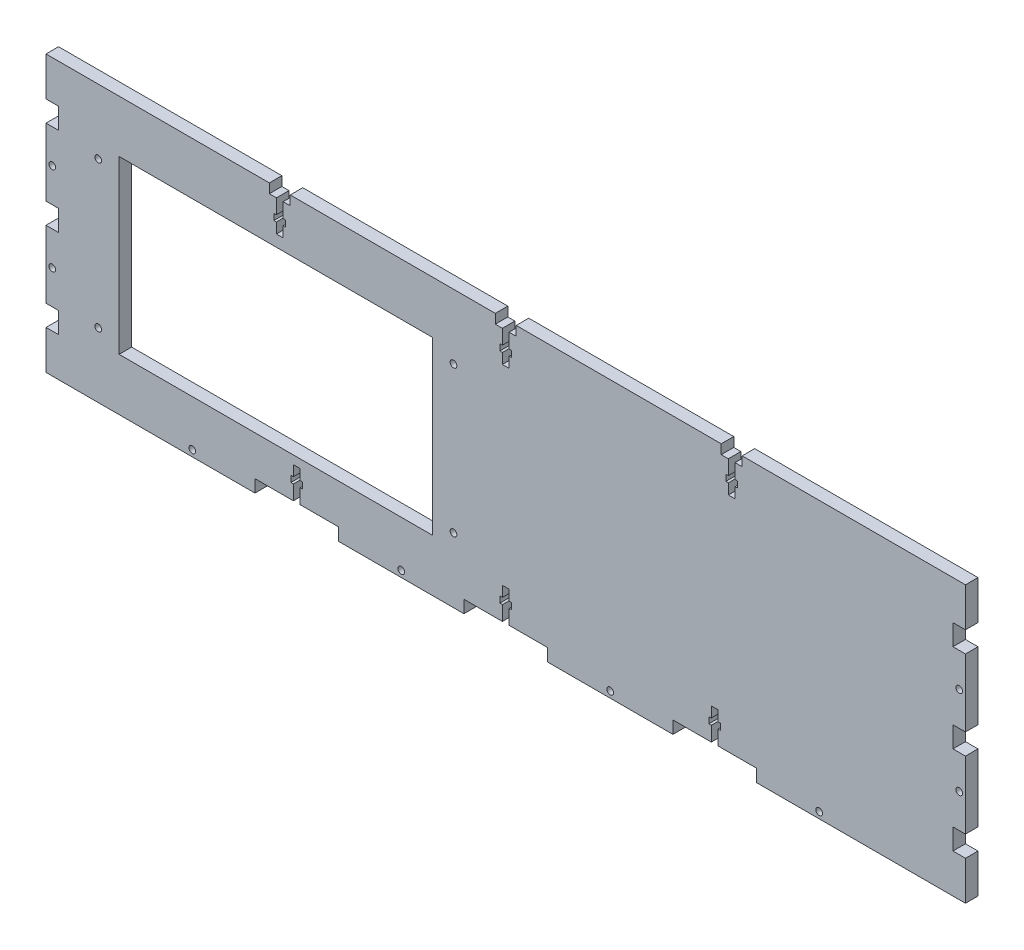
from build123d import *

# Parameters (mm, degrees)
SKETCH1_W           = 440
SKETCH1_H           = 132
BOSS_EXTRUDE1_DEPTH = 6
CUT_EXTRUDE1_REACH  = 231.765
SKETCH2_R           = 1.6
SKETCH2_W           = 6
SKETCH2_H           = 10
CUT_EXTRUDE2_REACH  = 231.765
SKETCH3_R           = 1.6
CUT_EXTRUDE3_REACH  = 231.765
SKETCH4_W           = 40
SKETCH4_H           = 6
SKETCH5_W           = 10
SKETCH5_H           = 6
CUT_EXTRUDE4_DEPTH  = 4.5
CUT_EXTRUDE5_REACH  = 231.765
SKETCH7_R           = 1.6
SKETCH7_W           = 150
SKETCH7_H           = 82
CUT_EXTRUDE6_DEPTH  = 230.765097436


with BuildPart() as part:
    # Sketch1 → Boss-Extrude1 (new body)
    with BuildSketch(Plane.XY):
        Rectangle(SKETCH1_W, SKETCH1_H)
    extrude(amount=BOSS_EXTRUDE1_DEPTH)

    # Sketch2 → Cut-Extrude1 (cut, up to next)
    with BuildSketch(Plane(origin=(0, 0, 0), x_dir=(-1, 0, 0), z_dir=(0, 0, -1)), mode=Mode.PRIVATE) as cut_extrude1_sk1:
        with Locations((217, 21.166064391)):
            Circle(SKETCH2_R)
    cut_extrude1_tool1 = extrude(cut_extrude1_sk1.sketch, amount=-CUT_EXTRUDE1_REACH, mode=Mode.PRIVATE) & part.part
    # Sketch2 → Cut-Extrude1 (cut, up to next)
    with BuildSketch(Plane(origin=(0, 0, 0), x_dir=(-1, 0, 0), z_dir=(0, 0, -1)), mode=Mode.PRIVATE) as cut_extrude1_sk2:
        with Locations((217, -21.166064391)):
            Circle(SKETCH2_R)
    cut_extrude1_tool2 = extrude(cut_extrude1_sk2.sketch, amount=-CUT_EXTRUDE1_REACH, mode=Mode.PRIVATE) & part.part
    # Sketch2 → Cut-Extrude1 (cut, up to next)
    with BuildSketch(Plane(origin=(0, 0, 0), x_dir=(-1, 0, 0), z_dir=(0, 0, -1)), mode=Mode.PRIVATE) as cut_extrude1_sk3:
        with Locations((-217, 21.166064391)):
            Circle(SKETCH2_R)
    cut_extrude1_tool3 = extrude(cut_extrude1_sk3.sketch, amount=-CUT_EXTRUDE1_REACH, mode=Mode.PRIVATE) & part.part
    # Sketch2 → Cut-Extrude1 (cut, up to next)
    with BuildSketch(Plane(origin=(0, 0, 0), x_dir=(-1, 0, 0), z_dir=(0, 0, -1)), mode=Mode.PRIVATE) as cut_extrude1_sk4:
        with Locations((-217, -21.166064391)):
            Circle(SKETCH2_R)
    cut_extrude1_tool4 = extrude(cut_extrude1_sk4.sketch, amount=-CUT_EXTRUDE1_REACH, mode=Mode.PRIVATE) & part.part
    # Sketch2 → Cut-Extrude1 (cut, up to next)
    with BuildSketch(Plane(origin=(0, 0, 0), x_dir=(-1, 0, 0), z_dir=(0, 0, -1)), mode=Mode.PRIVATE) as cut_extrude1_sk5:
        with Locations((217, 42.332128782)):
            Rectangle(SKETCH2_W, SKETCH2_H)
    cut_extrude1_tool5 = extrude(cut_extrude1_sk5.sketch, amount=-CUT_EXTRUDE1_REACH, mode=Mode.PRIVATE) & part.part
    # Sketch2 → Cut-Extrude1 (cut, up to next)
    with BuildSketch(Plane(origin=(0, 0, 0), x_dir=(-1, 0, 0), z_dir=(0, 0, -1)), mode=Mode.PRIVATE) as cut_extrude1_sk6:
        with Locations((217, -42.332128782)):
            Rectangle(SKETCH2_W, SKETCH2_H)
    cut_extrude1_tool6 = extrude(cut_extrude1_sk6.sketch, amount=-CUT_EXTRUDE1_REACH, mode=Mode.PRIVATE) & part.part
    # Sketch2 → Cut-Extrude1 (cut, up to next)
    with BuildSketch(Plane(origin=(0, 0, 0), x_dir=(-1, 0, 0), z_dir=(0, 0, -1)), mode=Mode.PRIVATE) as cut_extrude1_sk7:
        with Locations((-217, -42.332128782)):
            Rectangle(SKETCH2_W, SKETCH2_H)
    cut_extrude1_tool7 = extrude(cut_extrude1_sk7.sketch, amount=-CUT_EXTRUDE1_REACH, mode=Mode.PRIVATE) & part.part
    # Sketch2 → Cut-Extrude1 (cut, up to next)
    with BuildSketch(Plane(origin=(0, 0, 0), x_dir=(-1, 0, 0), z_dir=(0, 0, -1)), mode=Mode.PRIVATE) as cut_extrude1_sk8:
        with Locations((-217, 42.332128782)):
            Rectangle(SKETCH2_W, SKETCH2_H)
    cut_extrude1_tool8 = extrude(cut_extrude1_sk8.sketch, amount=-CUT_EXTRUDE1_REACH, mode=Mode.PRIVATE) & part.part
    # Sketch2 → Cut-Extrude1 (cut, up to next)
    with BuildSketch(Plane(origin=(0, 0, 0), x_dir=(-1, 0, 0), z_dir=(0, 0, -1)), mode=Mode.PRIVATE) as cut_extrude1_sk9:
        with Locations((217, 0)):
            Rectangle(SKETCH2_W, SKETCH2_H)
    cut_extrude1_tool9 = extrude(cut_extrude1_sk9.sketch, amount=-CUT_EXTRUDE1_REACH, mode=Mode.PRIVATE) & part.part
    # Sketch2 → Cut-Extrude1 (cut, up to next)
    with BuildSketch(Plane(origin=(0, 0, 0), x_dir=(-1, 0, 0), z_dir=(0, 0, -1)), mode=Mode.PRIVATE) as cut_extrude1_sk10:
        with Locations((-217, 0)):
            Rectangle(SKETCH2_W, SKETCH2_H)
    cut_extrude1_tool10 = extrude(cut_extrude1_sk10.sketch, amount=-CUT_EXTRUDE1_REACH, mode=Mode.PRIVATE) & part.part
    add(cut_extrude1_tool1.solids().sort_by_distance((-217, 21.166064, 0))[0], mode=Mode.SUBTRACT)
    add(cut_extrude1_tool2.solids().sort_by_distance((-217, -21.166064, 0))[0], mode=Mode.SUBTRACT)
    add(cut_extrude1_tool3.solids().sort_by_distance((217, 21.166064, 0))[0], mode=Mode.SUBTRACT)
    add(cut_extrude1_tool4.solids().sort_by_distance((217, -21.166064, 0))[0], mode=Mode.SUBTRACT)
    add(cut_extrude1_tool5.solids().sort_by_distance((-217, 42.332129, 0))[0], mode=Mode.SUBTRACT)
    add(cut_extrude1_tool6.solids().sort_by_distance((-217, -42.332129, 0))[0], mode=Mode.SUBTRACT)
    add(cut_extrude1_tool7.solids().sort_by_distance((217, -42.332129, 0))[0], mode=Mode.SUBTRACT)
    add(cut_extrude1_tool8.solids().sort_by_distance((217, 42.332129, 0))[0], mode=Mode.SUBTRACT)
    add(cut_extrude1_tool9.solids().sort_by_distance((-217, 0, 0))[0], mode=Mode.SUBTRACT)
    add(cut_extrude1_tool10.solids().sort_by_distance((217, 0, 0))[0], mode=Mode.SUBTRACT)

    # Sketch3 → Cut-Extrude2 (cut, up to next)
    with BuildSketch(Plane(origin=(0, 0, 0), x_dir=(-1, 0, 0), z_dir=(0, 0, -1)), mode=Mode.PRIVATE) as cut_extrude2_sk1:
        with Locations((-150, -63)):
            Circle(SKETCH3_R)
    cut_extrude2_tool1 = extrude(cut_extrude2_sk1.sketch, amount=-CUT_EXTRUDE2_REACH, mode=Mode.PRIVATE) & part.part
    # Sketch3 → Cut-Extrude2 (cut, up to next)
    with BuildSketch(Plane(origin=(0, 0, 0), x_dir=(-1, 0, 0), z_dir=(0, 0, -1)), mode=Mode.PRIVATE) as cut_extrude2_sk2:
        with Locations((-50, -63)):
            Circle(SKETCH3_R)
    cut_extrude2_tool2 = extrude(cut_extrude2_sk2.sketch, amount=-CUT_EXTRUDE2_REACH, mode=Mode.PRIVATE) & part.part
    # Sketch3 → Cut-Extrude2 (cut, up to next)
    with BuildSketch(Plane(origin=(0, 0, 0), x_dir=(-1, 0, 0), z_dir=(0, 0, -1)), mode=Mode.PRIVATE) as cut_extrude2_sk3:
        with Locations((50, -63)):
            Circle(SKETCH3_R)
    cut_extrude2_tool3 = extrude(cut_extrude2_sk3.sketch, amount=-CUT_EXTRUDE2_REACH, mode=Mode.PRIVATE) & part.part
    # Sketch3 → Cut-Extrude2 (cut, up to next)
    with BuildSketch(Plane(origin=(0, 0, 0), x_dir=(-1, 0, 0), z_dir=(0, 0, -1)), mode=Mode.PRIVATE) as cut_extrude2_sk4:
        with Locations((150, -63)):
            Circle(SKETCH3_R)
    cut_extrude2_tool4 = extrude(cut_extrude2_sk4.sketch, amount=-CUT_EXTRUDE2_REACH, mode=Mode.PRIVATE) & part.part
    add(cut_extrude2_tool1.solids().sort_by_distance((150, -63, 0))[0], mode=Mode.SUBTRACT)
    add(cut_extrude2_tool2.solids().sort_by_distance((50, -63, 0))[0], mode=Mode.SUBTRACT)
    add(cut_extrude2_tool3.solids().sort_by_distance((-50, -63, 0))[0], mode=Mode.SUBTRACT)
    add(cut_extrude2_tool4.solids().sort_by_distance((-150, -63, 0))[0], mode=Mode.SUBTRACT)

    # Sketch4 → Cut-Extrude3 (cut, up to next)
    with BuildSketch(Plane(origin=(0, 0, 0), x_dir=(-1, 0, 0), z_dir=(0, 0, -1)), mode=Mode.PRIVATE) as cut_extrude3_sk1:
        with Locations((100, -63)):
            Rectangle(SKETCH4_W, SKETCH4_H)
    cut_extrude3_tool1 = extrude(cut_extrude3_sk1.sketch, amount=-CUT_EXTRUDE3_REACH, mode=Mode.PRIVATE) & part.part
    # Sketch4 → Cut-Extrude3 (cut, up to next)
    with BuildSketch(Plane(origin=(0, 0, 0), x_dir=(-1, 0, 0), z_dir=(0, 0, -1)), mode=Mode.PRIVATE) as cut_extrude3_sk2:
        with Locations((0, -63)):
            Rectangle(SKETCH4_W, SKETCH4_H)
    cut_extrude3_tool2 = extrude(cut_extrude3_sk2.sketch, amount=-CUT_EXTRUDE3_REACH, mode=Mode.PRIVATE) & part.part
    # Sketch4 → Cut-Extrude3 (cut, up to next)
    with BuildSketch(Plane(origin=(0, 0, 0), x_dir=(-1, 0, 0), z_dir=(0, 0, -1)), mode=Mode.PRIVATE) as cut_extrude3_sk3:
        with Locations((-100, -63)):
            Rectangle(SKETCH4_W, SKETCH4_H)
    cut_extrude3_tool3 = extrude(cut_extrude3_sk3.sketch, amount=-CUT_EXTRUDE3_REACH, mode=Mode.PRIVATE) & part.part
    add(cut_extrude3_tool1.solids().sort_by_distance((-100, -63, 0))[0], mode=Mode.SUBTRACT)
    add(cut_extrude3_tool2.solids().sort_by_distance((0, -63, 0))[0], mode=Mode.SUBTRACT)
    add(cut_extrude3_tool3.solids().sort_by_distance((100, -63, 0))[0], mode=Mode.SUBTRACT)

    # Sketch5 → Cut-Extrude4 (cut)
    with BuildSketch(Plane(origin=(0, 66, 0), x_dir=(1, 0, 0), z_dir=(0, 1, 0))):
        with Locations((-108.125, -3)):
            Rectangle(SKETCH5_W, SKETCH5_H)
        with Locations((0, -3)):
            Rectangle(SKETCH5_W, SKETCH5_H)
        with Locations((108.125, -3)):
            Rectangle(SKETCH5_W, SKETCH5_H)
    extrude(amount=-CUT_EXTRUDE4_DEPTH, mode=Mode.SUBTRACT)

    # Sketch6 → Cut-Extrude5 (cut, up to next)
    with BuildSketch(Plane(origin=(0, 0, 0), x_dir=(-1, 0, 0), z_dir=(0, 0, -1)), mode=Mode.PRIVATE) as cut_extrude5_sk1:
        Polygon((-109.725, 61.5), (-109.725, 54.5), (-110.925, 54.5), (-110.925, 51.5), (-109.725, 51.5), (-109.725, 46.5), (-106.525, 46.5), (-106.525, 51.5), (-105.325, 51.5), (-105.325, 54.5), (-106.525, 54.5), (-106.525, 61.5), align=None)
    cut_extrude5_tool1 = extrude(cut_extrude5_sk1.sketch, amount=-CUT_EXTRUDE5_REACH, mode=Mode.PRIVATE) & part.part
    # Sketch6 → Cut-Extrude5 (cut, up to next)
    with BuildSketch(Plane(origin=(0, 0, 0), x_dir=(-1, 0, 0), z_dir=(0, 0, -1)), mode=Mode.PRIVATE) as cut_extrude5_sk2:
        Polygon((-1.595, 61.5), (-1.595, 54.5), (-2.795, 54.5), (-2.795, 51.5), (-1.595, 51.5), (-1.595, 46.5), (1.605, 46.5), (1.605, 51.5), (2.805, 51.5), (2.805, 54.5), (1.605, 54.5), (1.605, 61.5), align=None)
    cut_extrude5_tool2 = extrude(cut_extrude5_sk2.sketch, amount=-CUT_EXTRUDE5_REACH, mode=Mode.PRIVATE) & part.part
    # Sketch6 → Cut-Extrude5 (cut, up to next)
    with BuildSketch(Plane(origin=(0, 0, 0), x_dir=(-1, 0, 0), z_dir=(0, 0, -1)), mode=Mode.PRIVATE) as cut_extrude5_sk3:
        Polygon((106.535, 61.5), (106.535, 54.5), (105.335, 54.5), (105.335, 51.5), (106.535, 51.5), (106.535, 46.5), (109.735, 46.5), (109.735, 51.5), (110.935, 51.5), (110.935, 54.5), (109.735, 54.5), (109.735, 61.5), align=None)
    cut_extrude5_tool3 = extrude(cut_extrude5_sk3.sketch, amount=-CUT_EXTRUDE5_REACH, mode=Mode.PRIVATE) & part.part
    # Sketch6 → Cut-Extrude5 (cut, up to next)
    with BuildSketch(Plane(origin=(0, 0, 0), x_dir=(-1, 0, 0), z_dir=(0, 0, -1)), mode=Mode.PRIVATE) as cut_extrude5_sk4:
        Polygon((-98.4, -60), (-98.4, -53), (-97.2, -53), (-97.2, -50), (-98.4, -50), (-98.4, -45), (-101.6, -45), (-101.6, -50), (-102.8, -50), (-102.8, -53), (-101.6, -53), (-101.6, -60), align=None)
    cut_extrude5_tool4 = extrude(cut_extrude5_sk4.sketch, amount=-CUT_EXTRUDE5_REACH, mode=Mode.PRIVATE) & part.part
    # Sketch6 → Cut-Extrude5 (cut, up to next)
    with BuildSketch(Plane(origin=(0, 0, 0), x_dir=(-1, 0, 0), z_dir=(0, 0, -1)), mode=Mode.PRIVATE) as cut_extrude5_sk5:
        Polygon((1.6, -60), (1.6, -53), (2.8, -53), (2.8, -50), (1.6, -50), (1.6, -45), (-1.6, -45), (-1.6, -50), (-2.8, -50), (-2.8, -53), (-1.6, -53), (-1.6, -60), align=None)
    cut_extrude5_tool5 = extrude(cut_extrude5_sk5.sketch, amount=-CUT_EXTRUDE5_REACH, mode=Mode.PRIVATE) & part.part
    # Sketch6 → Cut-Extrude5 (cut, up to next)
    with BuildSketch(Plane(origin=(0, 0, 0), x_dir=(-1, 0, 0), z_dir=(0, 0, -1)), mode=Mode.PRIVATE) as cut_extrude5_sk6:
        Polygon((101.6, -60), (101.6, -53), (102.8, -53), (102.8, -50), (101.6, -50), (101.6, -45), (98.4, -45), (98.4, -50), (97.2, -50), (97.2, -53), (98.4, -53), (98.4, -60), align=None)
    cut_extrude5_tool6 = extrude(cut_extrude5_sk6.sketch, amount=-CUT_EXTRUDE5_REACH, mode=Mode.PRIVATE) & part.part
    add(cut_extrude5_tool1.solids().sort_by_distance((108.125, 53.869565, 0))[0], mode=Mode.SUBTRACT)
    add(cut_extrude5_tool2.solids().sort_by_distance((-0.005, 53.869565, 0))[0], mode=Mode.SUBTRACT)
    add(cut_extrude5_tool3.solids().sort_by_distance((-108.135, 53.869565, 0))[0], mode=Mode.SUBTRACT)
    add(cut_extrude5_tool4.solids().sort_by_distance((100, -52.369565, 0))[0], mode=Mode.SUBTRACT)
    add(cut_extrude5_tool5.solids().sort_by_distance((0, -52.369565, 0))[0], mode=Mode.SUBTRACT)
    add(cut_extrude5_tool6.solids().sort_by_distance((-100, -52.369565, 0))[0], mode=Mode.SUBTRACT)

    # Sketch7 → Cut-Extrude6 (cut, through all)
    with BuildSketch(Plane(origin=(0, 0, 0), x_dir=(-1, 0, 0), z_dir=(0, 0, -1))):
        with Locations((25, 35)):
            Circle(SKETCH7_R)
        with Locations((25, -35)):
            Circle(SKETCH7_R)
        with Locations((195, 35)):
            Circle(SKETCH7_R)
        with Locations((195, -35)):
            Circle(SKETCH7_R)
        with Locations((110, 0)):
            Rectangle(SKETCH7_W, SKETCH7_H)
    extrude(amount=-CUT_EXTRUDE6_DEPTH, mode=Mode.SUBTRACT)


solid = part.part
